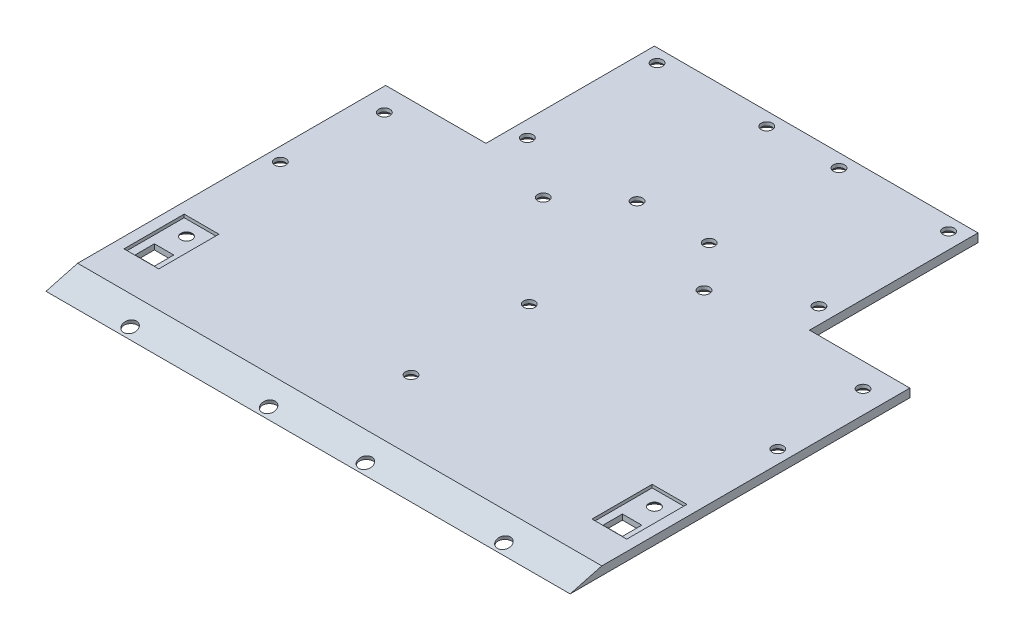
from build123d import *

# Parameters (mm, degrees)
SALIENTE_EXTRUIR1_DEPTH                              = 196
CORTAR_EXTRUIR1_REACH                                = 274.995
CROQUIS2_W                                           = 37.5
CROQUIS2_H                                           = 62.989872981
CROQUIS3_W                                           = 13
CROQUIS3_H                                           = 22.5
CORTAR_EXTRUIR2_DEPTH                                = 1.17
CORTAR_EXTRUIR3_REACH                                = 274.984
CROQUIS5_W                                           = 7.25
CROQUIS5_H                                           = 7.25
CORTAR_EXTRUIR4_REACH                                = 274.984
CROQUIS6_R                                           = 1.6
CUT_EXTRUDE1_REACH                                   = 274.995
SKETCH1_R                                            = 1.585
CUT_EXTRUDE2_REACH                                   = 274.995
SKETCH2_R                                            = 1.585
CUT_EXTRUDE3_REACH                                   = 274.995
SKETCH3_R                                            = 1.579889923
SKETCH3_R_2                                          = 1.585
SKETCH4_R                                            = 1.6
CUT_EXTRUDE4_DEPTH                                   = 4.9
AVELLANADO_PARA_TORNILLO_CON_CABEZA_AVEL_D           = 4.2
AVELLANADO_PARA_TORNILLO_CON_CABEZA_AVEL_DEPTH       = 10
AVELLANADO_PARA_TORNILLO_CON_CABEZA_AVEL_CSINK_D     = 8
AVELLANADO_PARA_TORNILLO_CON_CABEZA_AVEL_CSINK_ANGLE = 92
AVELLANADO_PARA_TORNILLO_CON_CABEZA_AVEL_TIP         = 1.2618073
SKETCH6_R                                            = 1.585
CUT_EXTRUDE5_DEPTH                                   = 10
SKETCH8_R                                            = 2.5
CUT_EXTRUDE6_DEPTH                                   = 10
AVELLANADO_PARA_TORNILLO_CON_CABEZA_2_D              = 4.2
AVELLANADO_PARA_TORNILLO_CON_CABEZA_2_DEPTH          = 10
AVELLANADO_PARA_TORNILLO_CON_CABEZA_2_CSINK_D        = 8
AVELLANADO_PARA_TORNILLO_CON_CABEZA_2_CSINK_ANGLE    = 92
AVELLANADO_PARA_TORNILLO_CON_CABEZA_2_TIP            = 1.2618073


with BuildPart() as part:
    # Croquis1 → Saliente-Extruir1 (new body)
    with BuildSketch(Plane(origin=(0, 0, 0), x_dir=(0, 0, -1), z_dir=(1, 0, 0))):
        Polygon((0, 0), (190, 0), (190, 3.17), (11.83060106, 3.17), align=None)
    extrude(amount=SALIENTE_EXTRUIR1_DEPTH)

    # Croquis2 → Cortar-Extruir1 (cut, up to next)
    with BuildSketch(Plane(origin=(0, 0, 0), x_dir=(-1, 0, 0), z_dir=(0, -1, 0)), mode=Mode.PRIVATE) as cortar_extruir1_sk1:
        with Locations((-18.75, 158.50506351)):
            Rectangle(CROQUIS2_W, CROQUIS2_H)
    cortar_extruir1_tool1 = extrude(cortar_extruir1_sk1.sketch, amount=-CORTAR_EXTRUIR1_REACH, mode=Mode.PRIVATE) & part.part
    cortar_extruir1 = cortar_extruir1_tool1.solids().sort_by_distance((18.75, 0, -158.505064))[0]
    add(cortar_extruir1, mode=Mode.SUBTRACT)

    # Simetría1: Cortar-Extruir1 across plane
    add(cortar_extruir1.mirror(Plane.ZY.offset(-98)), mode=Mode.SUBTRACT)

    # Croquis3 → Cortar-Extruir2 (cut)
    with BuildSketch(Plane(origin=(0, 3.17, 0), x_dir=(1, 0, 0), z_dir=(0, 1, 0))):
        with Locations((10.5, 36.41)):
            Rectangle(CROQUIS3_W, CROQUIS3_H)
    cortar_extruir2 = extrude(amount=-CORTAR_EXTRUIR2_DEPTH, mode=Mode.SUBTRACT)

    # Croquis5 → Cortar-Extruir3 (cut, up to next)
    with BuildSketch(Plane(origin=(0, 2, 0), x_dir=(1, 0, 0), z_dir=(0, 1, 0)), mode=Mode.PRIVATE) as cortar_extruir3_sk1:
        with Locations((10.5, 30.035)):
            Rectangle(CROQUIS5_W, CROQUIS5_H)
    cortar_extruir3_tool1 = extrude(cortar_extruir3_sk1.sketch, amount=-CORTAR_EXTRUIR3_REACH, mode=Mode.PRIVATE) & part.part
    cortar_extruir3 = cortar_extruir3_tool1.solids().sort_by_distance((10.5, 2, -30.035))[0]
    add(cortar_extruir3, mode=Mode.SUBTRACT)

    # Croquis6 → Cortar-Extruir4 (cut, up to next)
    with BuildSketch(Plane(origin=(0, 2, 0), x_dir=(1, 0, 0), z_dir=(0, 1, 0)), mode=Mode.PRIVATE) as cortar_extruir4_sk1:
        with Locations((10.5, 42.01)):
            Circle(CROQUIS6_R)
    cortar_extruir4_tool1 = extrude(cortar_extruir4_sk1.sketch, amount=-CORTAR_EXTRUIR4_REACH, mode=Mode.PRIVATE) & part.part
    cortar_extruir4 = cortar_extruir4_tool1.solids().sort_by_distance((10.5, 2, -42.01))[0]
    add(cortar_extruir4, mode=Mode.SUBTRACT)

    # Simetría2: Cortar-Extruir2, Cortar-Extruir3, Cortar-Extruir4 across plane
    add(cortar_extruir2.mirror(Plane.ZY.offset(-98)), mode=Mode.SUBTRACT)
    add(cortar_extruir3.mirror(Plane.ZY.offset(-98)), mode=Mode.SUBTRACT)
    add(cortar_extruir4.mirror(Plane.ZY.offset(-98)), mode=Mode.SUBTRACT)

    # Sketch1 → Cut-Extrude1 (cut, up to next)
    with BuildSketch(Plane(origin=(0, 3.17, 0), x_dir=(1, 0, 0), z_dir=(0, 1, 0)), mode=Mode.PRIVATE) as cut_extrude1_sk1:
        with Locations((8.5, 118.010127019)):
            Circle(SKETCH1_R)
    cut_extrude1_tool1 = extrude(cut_extrude1_sk1.sketch, amount=-CUT_EXTRUDE1_REACH, mode=Mode.PRIVATE) & part.part
    # Sketch1 → Cut-Extrude1 (cut, up to next)
    with BuildSketch(Plane(origin=(0, 3.17, 0), x_dir=(1, 0, 0), z_dir=(0, 1, 0)), mode=Mode.PRIVATE) as cut_extrude1_sk2:
        with Locations((187.5, 118.010127019)):
            Circle(SKETCH1_R)
    cut_extrude1_tool2 = extrude(cut_extrude1_sk2.sketch, amount=-CUT_EXTRUDE1_REACH, mode=Mode.PRIVATE) & part.part
    add(cut_extrude1_tool1.solids().sort_by_distance((8.5, 3.17, -118.010127))[0], mode=Mode.SUBTRACT)
    add(cut_extrude1_tool2.solids().sort_by_distance((187.5, 3.17, -118.010127))[0], mode=Mode.SUBTRACT)

    # Sketch2 → Cut-Extrude2 (cut, up to next)
    with BuildSketch(Plane(origin=(0, 3.17, 0), x_dir=(1, 0, 0), z_dir=(0, 1, 0)), mode=Mode.PRIVATE) as cut_extrude2_sk1:
        with Locations((98.5, 38.010127019)):
            Circle(SKETCH2_R)
    cut_extrude2_tool1 = extrude(cut_extrude2_sk1.sketch, amount=-CUT_EXTRUDE2_REACH, mode=Mode.PRIVATE) & part.part
    add(cut_extrude2_tool1.solids().sort_by_distance((98.5, 3.17, -38.010127))[0], mode=Mode.SUBTRACT)

    # Sketch3 → Cut-Extrude3 (cut, up to next)
    with BuildSketch(Plane(origin=(0, 3.17, 0), x_dir=(1, 0, 0), z_dir=(0, 1, 0)), mode=Mode.PRIVATE) as cut_extrude3_sk1:
        with Locations((43.5, 185)):
            Circle(SKETCH3_R)
    cut_extrude3_tool1 = extrude(cut_extrude3_sk1.sketch, amount=-CUT_EXTRUDE3_REACH, mode=Mode.PRIVATE) & part.part
    # Sketch3 → Cut-Extrude3 (cut, up to next)
    with BuildSketch(Plane(origin=(0, 3.17, 0), x_dir=(1, 0, 0), z_dir=(0, 1, 0)), mode=Mode.PRIVATE) as cut_extrude3_sk2:
        with Locations((84.5, 185)):
            Circle(SKETCH3_R_2)
    cut_extrude3_tool2 = extrude(cut_extrude3_sk2.sketch, amount=-CUT_EXTRUDE3_REACH, mode=Mode.PRIVATE) & part.part
    # Sketch3 → Cut-Extrude3 (cut, up to next)
    with BuildSketch(Plane(origin=(0, 3.17, 0), x_dir=(1, 0, 0), z_dir=(0, 1, 0)), mode=Mode.PRIVATE) as cut_extrude3_sk3:
        with Locations((152.5, 185)):
            Circle(SKETCH3_R_2)
    cut_extrude3_tool3 = extrude(cut_extrude3_sk3.sketch, amount=-CUT_EXTRUDE3_REACH, mode=Mode.PRIVATE) & part.part
    # Sketch3 → Cut-Extrude3 (cut, up to next)
    with BuildSketch(Plane(origin=(0, 3.17, 0), x_dir=(1, 0, 0), z_dir=(0, 1, 0)), mode=Mode.PRIVATE) as cut_extrude3_sk4:
        with Locations((111.5, 185)):
            Circle(SKETCH3_R_2)
    cut_extrude3_tool4 = extrude(cut_extrude3_sk4.sketch, amount=-CUT_EXTRUDE3_REACH, mode=Mode.PRIVATE) & part.part
    # Sketch3 → Cut-Extrude3 (cut, up to next)
    with BuildSketch(Plane(origin=(0, 3.17, 0), x_dir=(1, 0, 0), z_dir=(0, 1, 0)), mode=Mode.PRIVATE) as cut_extrude3_sk5:
        with Locations((111.5, 136.5)):
            Circle(SKETCH3_R_2)
    cut_extrude3_tool5 = extrude(cut_extrude3_sk5.sketch, amount=-CUT_EXTRUDE3_REACH, mode=Mode.PRIVATE) & part.part
    # Sketch3 → Cut-Extrude3 (cut, up to next)
    with BuildSketch(Plane(origin=(0, 3.17, 0), x_dir=(1, 0, 0), z_dir=(0, 1, 0)), mode=Mode.PRIVATE) as cut_extrude3_sk6:
        with Locations((152.5, 136.5)):
            Circle(SKETCH3_R_2)
    cut_extrude3_tool6 = extrude(cut_extrude3_sk6.sketch, amount=-CUT_EXTRUDE3_REACH, mode=Mode.PRIVATE) & part.part
    # Sketch3 → Cut-Extrude3 (cut, up to next)
    with BuildSketch(Plane(origin=(0, 3.17, 0), x_dir=(1, 0, 0), z_dir=(0, 1, 0)), mode=Mode.PRIVATE) as cut_extrude3_sk7:
        with Locations((84.5, 136.5)):
            Circle(SKETCH3_R_2)
    cut_extrude3_tool7 = extrude(cut_extrude3_sk7.sketch, amount=-CUT_EXTRUDE3_REACH, mode=Mode.PRIVATE) & part.part
    # Sketch3 → Cut-Extrude3 (cut, up to next)
    with BuildSketch(Plane(origin=(0, 3.17, 0), x_dir=(1, 0, 0), z_dir=(0, 1, 0)), mode=Mode.PRIVATE) as cut_extrude3_sk8:
        with Locations((43.5, 136.5)):
            Circle(SKETCH3_R_2)
    cut_extrude3_tool8 = extrude(cut_extrude3_sk8.sketch, amount=-CUT_EXTRUDE3_REACH, mode=Mode.PRIVATE) & part.part
    add(cut_extrude3_tool1.solids().sort_by_distance((43.5, 3.17, -185))[0], mode=Mode.SUBTRACT)
    add(cut_extrude3_tool2.solids().sort_by_distance((84.5, 3.17, -185))[0], mode=Mode.SUBTRACT)
    add(cut_extrude3_tool3.solids().sort_by_distance((152.5, 3.17, -185))[0], mode=Mode.SUBTRACT)
    add(cut_extrude3_tool4.solids().sort_by_distance((111.5, 3.17, -185))[0], mode=Mode.SUBTRACT)
    add(cut_extrude3_tool5.solids().sort_by_distance((111.5, 3.17, -136.5))[0], mode=Mode.SUBTRACT)
    add(cut_extrude3_tool6.solids().sort_by_distance((152.5, 3.17, -136.5))[0], mode=Mode.SUBTRACT)
    add(cut_extrude3_tool7.solids().sort_by_distance((84.5, 3.17, -136.5))[0], mode=Mode.SUBTRACT)
    add(cut_extrude3_tool8.solids().sort_by_distance((43.5, 3.17, -136.5))[0], mode=Mode.SUBTRACT)

    # Sketch4 → Cut-Extrude4 (cut)
    with BuildSketch(Plane(origin=(0, 3.17, 0), x_dir=(1, 0, 0), z_dir=(0, 1, 0))):
        with Locations((65.776416732, 120.166862559)):
            Circle(SKETCH4_R)
        with Locations((125.876416732, 120.166862559)):
            Circle(SKETCH4_R)
    extrude(amount=-CUT_EXTRUDE4_DEPTH, mode=Mode.SUBTRACT)

    # Avellanado para tornillo con cabeza avel
    with Locations(Plane(origin=(187.5, 0, -118.010127019), x_dir=(0, 0, -1), z_dir=(0, -1, 0))):
        with Locations((0, 0), (18.489872981, -35), (2.15673554, -61.623583268), (18.489872981, -76), (18.489872981, -103), (2.15673554, -121.723583268), (18.489872981, -144), (0, -179), (66.989872981, -144), (66.989872981, -103), (66.989872981, -76), (66.989872981, -35), (-76.000127019, -177), (-80, -89), (-76.000127019, -2)):
            CounterSinkHole(AVELLANADO_PARA_TORNILLO_CON_CABEZA_AVEL_D / 2, AVELLANADO_PARA_TORNILLO_CON_CABEZA_AVEL_CSINK_D / 2, depth=AVELLANADO_PARA_TORNILLO_CON_CABEZA_AVEL_DEPTH, counter_sink_angle=AVELLANADO_PARA_TORNILLO_CON_CABEZA_AVEL_CSINK_ANGLE)
            with Locations((0, 0, -(AVELLANADO_PARA_TORNILLO_CON_CABEZA_AVEL_DEPTH + AVELLANADO_PARA_TORNILLO_CON_CABEZA_AVEL_TIP / 2))):  # 118° drill point
                Cone(0, AVELLANADO_PARA_TORNILLO_CON_CABEZA_AVEL_D / 2, AVELLANADO_PARA_TORNILLO_CON_CABEZA_AVEL_TIP, mode=Mode.SUBTRACT)

    # Sketch6 → Cut-Extrude5 (cut)
    with BuildSketch(Plane(origin=(0, 3.17, 0), x_dir=(1, 0, 0), z_dir=(0, 1, 0))):
        with Locations((191.067111952, 82.557811806)):
            Circle(SKETCH6_R)
        with Locations((97.681935477, 83.038529763)):
            Circle(SKETCH6_R)
        with Locations((5.067111952, 82.557811806)):
            Circle(SKETCH6_R)
    extrude(amount=-CUT_EXTRUDE5_DEPTH, mode=Mode.SUBTRACT)

    # Sketch8 → Cut-Extrude6 (cut)
    with BuildSketch(Plane(origin=(0, 0, 0), x_dir=(1, 0, 0), z_dir=(0, 0.9659258262890681, 0.2588190451025218))):
        with Locations((28.1, 3.449548762)):
            Circle(SKETCH8_R)
        with Locations((79.9, 3.449548762)):
            Circle(SKETCH8_R)
        with Locations((116.1, 3.449548762)):
            Circle(SKETCH8_R)
        with Locations((167.9, 3.449548762)):
            Circle(SKETCH8_R)
    extrude(amount=-CUT_EXTRUDE6_DEPTH, mode=Mode.SUBTRACT)

    # Avellanado para tornillo con cabeza  2
    with Locations(Plane(origin=(97.681935477, 0, -83.038529763), x_dir=(0, 0, -1), z_dir=(0, -1, 0))):
        with Locations((0, 0), (-0.480717957, -92.614823525), (-0.480717957, 93.385176475)):
            CounterSinkHole(AVELLANADO_PARA_TORNILLO_CON_CABEZA_2_D / 2, AVELLANADO_PARA_TORNILLO_CON_CABEZA_2_CSINK_D / 2, depth=AVELLANADO_PARA_TORNILLO_CON_CABEZA_2_DEPTH, counter_sink_angle=AVELLANADO_PARA_TORNILLO_CON_CABEZA_2_CSINK_ANGLE)
            with Locations((0, 0, -(AVELLANADO_PARA_TORNILLO_CON_CABEZA_2_DEPTH + AVELLANADO_PARA_TORNILLO_CON_CABEZA_2_TIP / 2))):  # 118° drill point
                Cone(0, AVELLANADO_PARA_TORNILLO_CON_CABEZA_2_D / 2, AVELLANADO_PARA_TORNILLO_CON_CABEZA_2_TIP, mode=Mode.SUBTRACT)


solid = part.part
